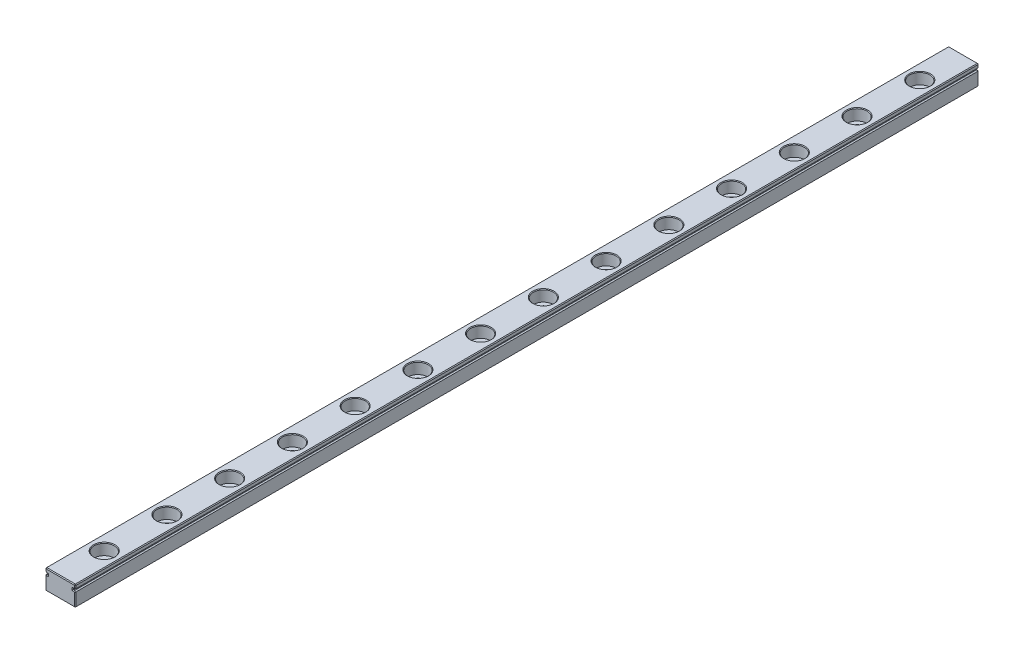
from build123d import *

# Parameters (mm, degrees)
BOSS_EXTRUDE1_DEPTH = 360
CHAMFER1_SIZE       = 0.3
LPATTERN1_COUNT     = 14
LPATTERN1_PITCH     = 25


with BuildPart() as part:
    # Sketch1 → Boss-Extrude1 (new body)
    with BuildSketch(Plane.XY):
        with BuildLine():
            Line((0, 8), (12, 8))
            Line((12, 8), (12, 6.75))
            Line((12, 6.75), (12, 6.559016994))
            ThreePointArc((12, 6.559016994), (11.706107374, 6.475528258), (11.5, 6.25))
            Line((11.5, 6.25), (11, 6.25))
            Line((11, 6.25), (11, 5.75))
            Line((11, 5.75), (11.5, 5.75))
            ThreePointArc((11.5, 5.75), (11.706107374, 5.524471742), (12, 5.440983006))
            Line((12, 5.440983006), (12, 5.25))
            Line((12, 5.25), (12, 0))
            Line((12, 0), (0, 0))
            Line((0, 0), (0, 5.25))
            Line((0, 5.25), (0, 5.440983006))
            ThreePointArc((0, 5.440983006), (0.293892626, 5.524471742), (0.5, 5.75))
            Line((0.5, 5.75), (1, 5.75))
            Line((1, 5.75), (1, 6.25))
            Line((1, 6.25), (0.5, 6.25))
            ThreePointArc((0.5, 6.25), (0.293892626, 6.475528258), (0, 6.559016994))
            Line((0, 6.559016994), (0, 6.75))
            Line((0, 6.75), (0, 8))
        make_face()
    extrude(amount=BOSS_EXTRUDE1_DEPTH)

    # Chamfer1
    chamfer1_edges = [part.edges().sort_by_distance(p)[0] for p in [
        (0, 0, 180),
        (12, 0, 180),
        (0, 8, 180),
        (12, 8, 180),
        (0.293892626, 5.524471742, 360),
        (0.75, 5.75, 360),
        (1, 6, 360),
        (0.75, 6.25, 360),
        (0.293892626, 6.475528258, 360),
        (0, 7.279508497, 360),
        (6, 8, 360),
        (12, 7.279508497, 360),
        (11.706107374, 6.475528258, 360),
        (11.25, 6.25, 360),
        (11, 6, 360),
        (11.25, 5.75, 360),
        (11.706107374, 5.524471742, 360),
        (12, 2.720491503, 360),
        (6, 0, 360),
        (0, 2.720491503, 360),
        (12, 2.720491503, 0),
        (11.706107374, 5.524471742, 0),
        (11.25, 5.75, 0),
        (11, 6, 0),
        (11.25, 6.25, 0),
        (11.706107374, 6.475528258, 0),
        (12, 7.279508497, 0),
        (6, 0, 0),
        (0, 2.720491503, 0),
        (0.293892626, 5.524471742, 0),
        (0.75, 5.75, 0),
        (1, 6, 0),
        (0.75, 6.25, 0),
        (0.293892626, 6.475528258, 0),
        (0, 7.279508497, 0),
        (6, 8, 0),
    ]]
    chamfer(chamfer1_edges, length=CHAMFER1_SIZE)

    # Sketch3 → CBORE for M5 Hex Head Bolt1 (revolve, cut)
    with BuildSketch(Plane(origin=(6, 8, 17.5), x_dir=(0, 0, 1), z_dir=(1, 0, 0))):
        Polygon((0, 0), (0, 8), (2.5, 8), (2.25, 7.75), (2.25, 4.5), (4, 4.5), (4, 0.25), (4.25, 0), align=None)
    cbore_for_m5_hex_head_bolt1 = revolve(axis=Axis((6, 14.35, 17.5), (0, -1, 0)), mode=Mode.SUBTRACT)

    # LPattern1: CBORE for M5 Hex Head Bolt1 ×14
    with Locations(*[(0, 0, i * LPATTERN1_PITCH) for i in range(1, LPATTERN1_COUNT)]):
        add(cbore_for_m5_hex_head_bolt1, mode=Mode.SUBTRACT)


solid = part.part
